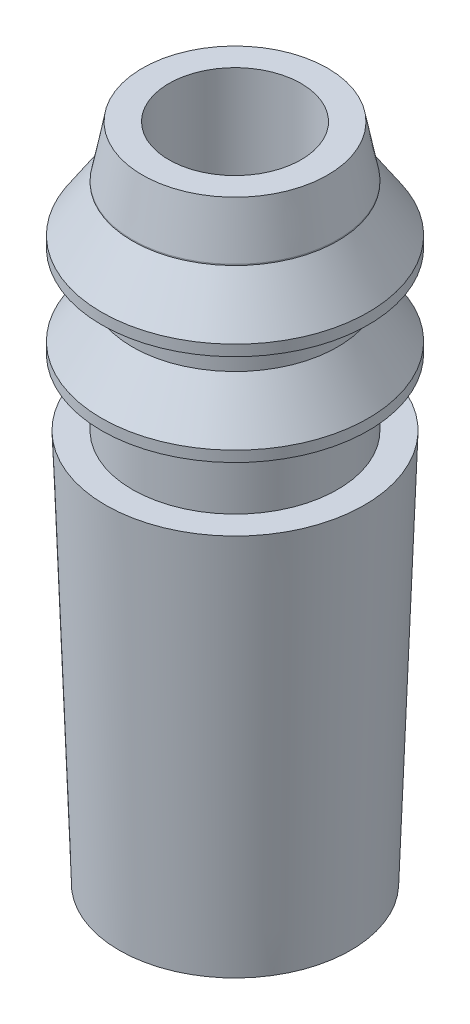
from build123d import *
from build123d.topology import SkipClean

# Parameters (mm, degrees)
SKETCH1_R           = 1.2
SKETCH1_R_2         = 0.6
BOSS_EXTRUDE1_DEPTH = 3.56
CHAMFER1_SIZE       = 4.295437992
CHAMFER1_SIZE_2     = 0.15
CHAMFER2_SIZE       = 0.09
CHAMFER2_SIZE2      = 0.463009861


with BuildPart() as part:
    # Sketch1 → Boss-Extrude1 (new body)
    with BuildSketch(Plane(origin=(0, 0, 0), x_dir=(1, 0, 0), z_dir=(0, 1, 0))):
        with Locations(Location((0, 0, 0), (0, 0, 270))):
            Circle(SKETCH1_R)
        with Locations(Location((0, 0, 0), (0, 0, 270))):
            Circle(SKETCH1_R_2, mode=Mode.SUBTRACT)
    extrude(amount=BOSS_EXTRUDE1_DEPTH)

    # Chamfer1
    # the kernel refuses this chamfer: 4.295437992, 0.15 mm, written as the material it takes off along each edge
    with BuildSketch(Plane(origin=(0, 0, 0), x_dir=(0, 0, 1), z_dir=(-1, 0, 0))) as chamfer1_piece_1:
        Polygon((1.2, CHAMFER1_SIZE), (1.2 - CHAMFER1_SIZE_2, 0), (1.2, 0), align=None)
    revolve(axis=Axis((0, 0, 0), (0, 1, 0)), mode=Mode.SUBTRACT)

    # Sketch2 → Revolve1 (revolve)
    with SkipClean():  # the faces are left unmerged after this step: merging them gives an invalid solid
        with BuildSketch(Plane.XY, mode=Mode.PRIVATE) as revolve1_sk:
            Polygon((-0.930249934, 3.56), (-0.6, 3.56), (-0.6, 5.985981573), (-0.930249934, 5.985981573), (-0.930249934, 5.512818609), (-1.209933354, 5.092839643), (-1.209933354, 4.994150585), (-0.930249934, 4.994150585), (-0.930249934, 4.679978965), (-1.209933354, 4.26), (-1.209933354, 4.162806989), (-0.930249934, 4.162806989), align=None)
        revolve(revolve1_sk.sketch.rotate(Axis((0, 3.56, 0), (0, 1, 0)), 270), axis=Axis((0, 3.56, 0), (0, 1, 0)))
    add(part.part.scale(1), mode=Mode.REPLACE)  # the faces are merged on a copy

    # Chamfer2
    chamfer2_edges = [part.edges().sort_by_distance(p)[0] for p in [
        (0, 5.985981573, 0.930249934),
    ]]
    chamfer2_side = [part.faces().sort_by_distance(p)[0] for p in [
        (0, 5.985981573, 0.626311441),
    ]]
    chamfer(chamfer2_edges, length=CHAMFER2_SIZE, length2=CHAMFER2_SIZE2, reference=chamfer2_side[0])


solid = part.part
